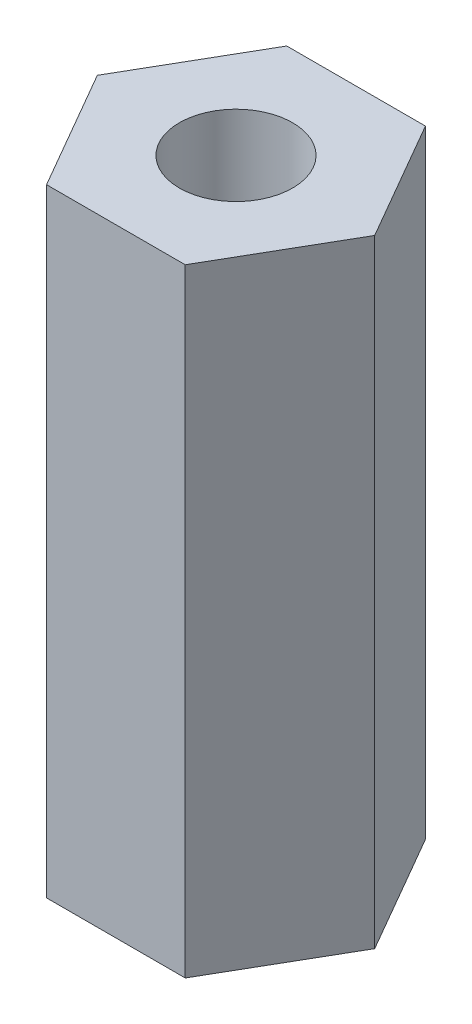
from build123d import *

# Parameters (mm, degrees)
SKETCH_1_R      = 1.65
EXTRUDE_2_DEPTH = 18


with BuildPart() as part:
    # 草图1 → 凸台-拉伸2 (new body)
    with BuildSketch(Plane(origin=(0, 0, 0), x_dir=(1, 0, 0), z_dir=(0, 1, 0))):
        Polygon((4.041451884, 0), (2.020725942, 3.5), (-2.020725942, 3.5), (-4.041451884, 0), (-2.020725942, -3.5), (2.020725942, -3.5), align=None)
        Circle(SKETCH_1_R, mode=Mode.SUBTRACT)
    extrude(amount=EXTRUDE_2_DEPTH)


solid = part.part
